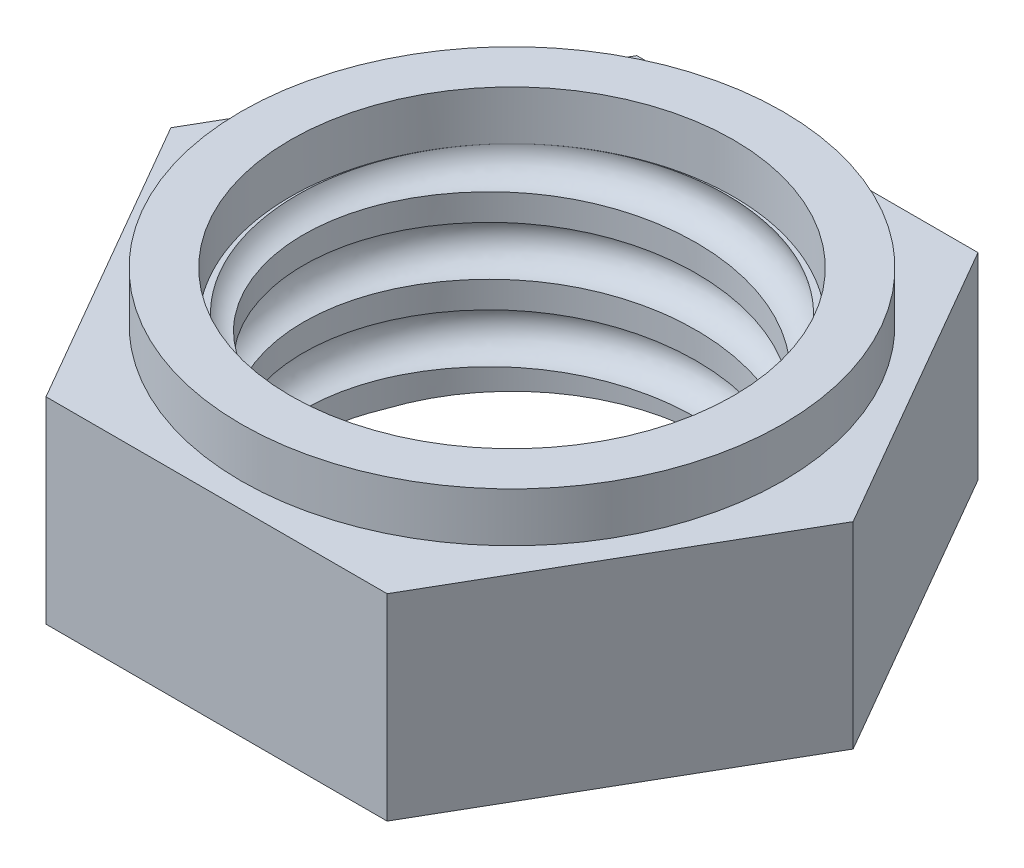
from build123d import *

# Parameters (mm, degrees)
BOSS_EXTRUDE1_DEPTH = 1.016
SKETCH2_R           = 1.016
CUT_EXTRUDE1_DEPTH  = 3.54
CUT_SWEEP1_PITCH    = 0.390769231
SKETCH5_R           = 1.397
SKETCH5_R_2         = 1.143
BOSS_EXTRUDE2_DEPTH = 0.254


with BuildPart() as part:
    # Sketch1 → Boss-Extrude1 (new body)
    with BuildSketch(Plane(origin=(0, 0, 0), x_dir=(1, 0, 0), z_dir=(0, 1, 0))):
        Polygon((0.87988181, 1.524), (-0.87988181, 1.524), (-1.75976362, 0), (-0.87988181, -1.524), (0.87988181, -1.524), (1.75976362, 0), align=None)
    extrude(amount=BOSS_EXTRUDE1_DEPTH)

    # Sketch2 → Cut-Extrude1 (cut, through all)
    with BuildSketch(Plane(origin=(0, 1.016, 0), x_dir=(1, 0, 0), z_dir=(0, 1, 0))):
        with Locations(Location((0, 0, 0), (0, 0, 270))):
            Circle(SKETCH2_R)
    extrude(amount=-CUT_EXTRUDE1_DEPTH, mode=Mode.SUBTRACT)

    # Cut-Sweep1: arcs per turn and ends read off the stored shape
    # Cut-Sweep1: the profile of Sketch4 screwed along a right-hand helix through 14 turns, 6 arcs to a turn; built about Z, then put on its axis
    cut_sweep1_z = Axis((0, 0, 0), (0, 0, 1))
    cut_sweep1_corners = [(0.888953392, 6.827e-06, -0.390769236), (1.015953392, 7.802e-06, -0.517769236), (1.142953392, 8.777e-06, -0.390769236), (1.015953392, 7.802e-06, -0.263769236)]
    with BuildLine(mode=Mode.PRIVATE) as cut_sweep1_profile:
        ThreePointArc((0.888953392, 6.827e-06, -0.390769236), (0.926150831, 7.112e-06, -0.480571797), (1.015953392, 7.802e-06, -0.517769236))
        ThreePointArc((1.015953392, 7.802e-06, -0.517769236), (1.105755953, 8.492e-06, -0.480571797), (1.142953392, 8.777e-06, -0.390769236))
        ThreePointArc((1.142953392, 8.777e-06, -0.390769236), (1.105755953, 8.492e-06, -0.300966675), (1.015953392, 7.802e-06, -0.263769236))
        ThreePointArc((1.015953392, 7.802e-06, -0.263769236), (0.926150831, 7.112e-06, -0.300966675), (0.888953392, 6.827e-06, -0.390769236))
    cut_sweep1_cap = Face(cut_sweep1_profile.wire())
    cut_sweep1_arcs = [((0.888953392, 6.827e-06, -0.390769236), (0.888953392, 6.827e-06, -0.517769236), (1.015953392, 7.802e-06, -0.517769236), (1, 0.7071067811865476, 1)), ((1.015953392, 7.802e-06, -0.517769236), (1.142953392, 8.777e-06, -0.517769236), (1.142953392, 8.777e-06, -0.390769236), (1, 0.7071067811865476, 1)), ((1.142953392, 8.777e-06, -0.390769236), (1.142953392, 8.777e-06, -0.263769236), (1.015953392, 7.802e-06, -0.263769236), (1, 0.7071067811865476, 1)), ((1.015953392, 7.802e-06, -0.263769236), (0.888953392, 6.827e-06, -0.263769236), (0.888953392, 6.827e-06, -0.390769236), (1, 0.7071067811865476, 1))]  # start, shoulder, end, weights
    cut_sweep1_turn_angles = [0, 30, 60, 90, 120, 150, 180, 210, 240, 270, 300, 330, 360]
    cut_sweep1_turn_weights = [1, 0.8660254037844387, 1, 0.8660254037844387, 1, 0.8660254037844387, 1, 0.8660254037844387, 1, 0.8660254037844387, 1, 0.8660254037844387, 1]
    cut_sweep1_turn_sides = [Face.make_bezier_surface([[Vector(p[j][0], p[j][1], 0).rotate(cut_sweep1_z, cut_sweep1_turn_angles[2 * i + k]) / cut_sweep1_turn_weights[2 * i + k] + Vector(0, 0, p[j][2] + CUT_SWEEP1_PITCH * cut_sweep1_turn_angles[2 * i + k] / 360) for k in range(3)] for j in range(3)], [[p[3][j] * cut_sweep1_turn_weights[2 * i + k] for k in range(3)] for j in range(3)]) for p in cut_sweep1_arcs for i in range(6)]
    cut_sweep1 = Plane(origin=(0, 1.016, 0), x_dir=(-0.7071067811865537, 0, -0.7071067811865414), z_dir=(0, -1, 0)) * Solid(Shell([*[p.moved(Location((0, 0, CUT_SWEEP1_PITCH * i))) for i in range(14) for p in cut_sweep1_turn_sides], cut_sweep1_cap, cut_sweep1_cap.rotate(cut_sweep1_z, 5040).moved(Location((0, 0, CUT_SWEEP1_PITCH * 5040 / 360)))]))
    add(cut_sweep1, mode=Mode.SUBTRACT)

    # Sketch5 → Boss-Extrude2 (add)
    with BuildSketch(Plane(origin=(0, 1.016, 0), x_dir=(1, 0, 0), z_dir=(0, 1, 0))):
        with Locations(Location((0, 0, 0), (0, 0, 270))):
            Circle(SKETCH5_R)
        with Locations(Location((0, 0, 0), (0, 0, 270))):
            Circle(SKETCH5_R_2, mode=Mode.SUBTRACT)
    extrude(amount=BOSS_EXTRUDE2_DEPTH)


solid = part.part
